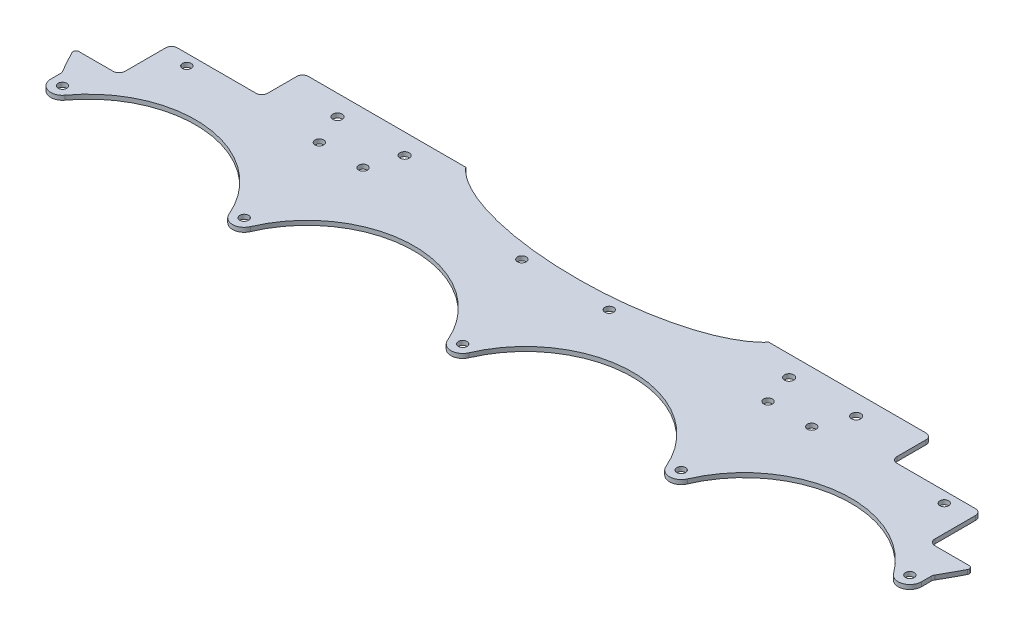
from build123d import *
from build123d.topology import SkipClean

# Parameters (mm, degrees)
ESQUISSE1_R               = 1.5
T_LE_DE_BASE_PLI_E1_DEPTH = 1.5
CONG_1_R                  = 2
CONG_2_R                  = 1
ESQUISSE2_W               = 108
ESQUISSE2_H               = 14
PATTE1_DEPTH              = 1.5
CONG_3_R                  = 2
ENL_V_MAT_EXTRU_1_DEPTH   = 1.5
ESQUISSE6_R               = 1.5
ENL_V_MAT_EXTRU_2_DEPTH   = 1.5
ESQUISSE7_R               = 1.6
ENL_V_MAT_EXTRU_3_DEPTH   = 1.5


# Sheet-metal steps are written as plain solids
with BuildPart() as part:
    # Esquisse1 → Tôle de base pliée1 (new body)
    with BuildSketch(Plane(origin=(0, 0, 0), x_dir=(1, 0, 0), z_dir=(0, 1, 0))):
        with BuildLine():
            Line((0, 14.447178434), (0, 11.947178434))
            ThreePointArc((0, 11.947178434), (-2.206641245, 12.610902903), (-3.680981595, 14.381811226))
            ThreePointArc((-3.680981595, 14.381811226), (-37.5, 36.75), (-71.319018405, 14.381811226))
            ThreePointArc((-71.319018405, 14.381811226), (-75, 11.947178434), (-78.680981595, 14.381811226))
            ThreePointArc((-78.680981595, 14.381811226), (-108.32543803, 36.512128565), (-142.200039192, 21.644171779))
            ThreePointArc((-142.200039192, 21.644171779), (-146.671520698, 20.196670583), (-149.432696519, 24))
            Line((-149.432696519, 24), (-149.432696519, 27.828506889))
            ThreePointArc((-149.432696519, 27.828506889), (-151.994672595, 32.376640695), (-154.418263169, 37))
            Line((-154.418263169, 37), (-139, 37))
            Line((-139, 37), (-139, 55))
            Line((-139, 55), (0, 55))
            Line((0, 55), (0, 17.447178434))
            ThreePointArc((0, 17.447178434), (-1.5, 15.947178434), (0, 14.447178434))
        make_face()
        with Locations(Location((-145.432696519, 24, 0), (0, 0, 270))):
            Circle(ESQUISSE1_R, mode=Mode.SUBTRACT)
        with Locations(Location((-75, 15.947178434, 0), (0, 0, 270))):
            Circle(ESQUISSE1_R, mode=Mode.SUBTRACT)
    extrude(amount=-T_LE_DE_BASE_PLI_E1_DEPTH)

    # Congé1
    cong_1_edges = [part.edges().sort_by_distance(p)[0] for p in [
        (-149.432696519, -0.75, -27.828506889),
        (-139, -0.75, -37),
        (-139, -0.75, -55),
    ]]
    fillet(cong_1_edges, radius=CONG_1_R)

    # Congé2
    cong_2_edges = [part.edges().sort_by_distance(p)[0] for p in [
        (-154.418263169, -0.75, -37),
    ]]
    fillet(cong_2_edges, radius=CONG_2_R)

    # Esquisse2 → Patte1 (add)
    with BuildSketch(Plane(origin=(0, 0, 0), x_dir=(1, 0, 0), z_dir=(0, 1, 0))):
        with Locations((-54, 62)):
            Rectangle(ESQUISSE2_W, ESQUISSE2_H)
    extrude(amount=-PATTE1_DEPTH)

    # Congé3
    cong_3_edges = [part.edges().sort_by_distance(p)[0] for p in [
        (-108, -0.75, -55),
        (-108, -0.75, -69),
    ]]
    fillet(cong_3_edges, radius=CONG_3_R)

    # Esquisse5 → Enlèv. mat.-Extru.1 (cut)
    with BuildSketch(Plane(origin=(0, 0, 0), x_dir=(1, 0, 0), z_dir=(0, 1, 0))):
        with BuildLine():
            Line((0, 69), (-52, 69))
            add(Edge.make_bspline(
                [(-52, 69), (-40, 55), (0, 55)],
                knots=[3.446285308, 3.446285308, 3.446285308, 4.71238898, 4.71238898, 4.71238898], degree=2, weights=[1, 0.806225775, 1]))
            Line((0, 55), (0, 69))
        make_face()
    extrude(amount=-ENL_V_MAT_EXTRU_1_DEPTH, mode=Mode.SUBTRACT)

    # Symétrie1: part across face


with BuildPart() as part_1:
    with SkipClean():  # the faces are left unmerged after this step: merging them gives an invalid solid
        add(part.part)
        add(part.part.mirror(Plane(origin=(0, -0.75, -36.223589217), x_dir=(0, 0, 1), z_dir=(1, 0, 0))))

    # Esquisse6 → Enlèv. mat.-Extru.2 (cut)
    with SkipClean():  # the faces are left unmerged after this step: merging them gives an invalid solid
        with BuildSketch(Plane(origin=(0, 0, 0), x_dir=(1, 0, 0), z_dir=(0, 1, 0))):
            with Locations(Location((-84.5, 51.25, 0), (0, 0, 270))):
                Circle(ESQUISSE6_R)
            with Locations(Location((-69.5, 51.25, 0), (0, 0, 270))):
                Circle(ESQUISSE6_R)
            with Locations(Location((84.5, 51.25, 0), (0, 0, 90))):
                Circle(ESQUISSE6_R)
            with Locations(Location((69.5, 51.25, 0), (0, 0, 90))):
                Circle(ESQUISSE6_R)
            with Locations(Location((-130, 51.25, 0), (0, 0, 270))):
                Circle(ESQUISSE6_R)
            with Locations(Location((130, 51.25, 0), (0, 0, 90))):
                Circle(ESQUISSE6_R)
            with Locations(Location((-15, 51.25, 0), (0, 0, 270))):
                Circle(ESQUISSE6_R)
            with Locations(Location((15, 51.25, 0), (0, 0, 90))):
                Circle(ESQUISSE6_R)
        extrude(amount=-ENL_V_MAT_EXTRU_2_DEPTH, mode=Mode.SUBTRACT)

    # Esquisse7 → Enlèv. mat.-Extru.3 (cut)
    with SkipClean():  # the faces are left unmerged after this step: merging them gives an invalid solid
        with BuildSketch(Plane(origin=(0, 0, 0), x_dir=(1, 0, 0), z_dir=(0, 1, 0))):
            with Locations(Location((-89, 62, 0), (0, 0, 270))):
                Circle(ESQUISSE7_R)
            with Locations(Location((-66, 62, 0), (0, 0, 270))):
                Circle(ESQUISSE7_R)
            with Locations(Location((89, 62, 0), (0, 0, 90))):
                Circle(ESQUISSE7_R)
            with Locations(Location((66, 62, 0), (0, 0, 90))):
                Circle(ESQUISSE7_R)
        extrude(amount=-ENL_V_MAT_EXTRU_3_DEPTH, mode=Mode.SUBTRACT)


solid = part_1.part
